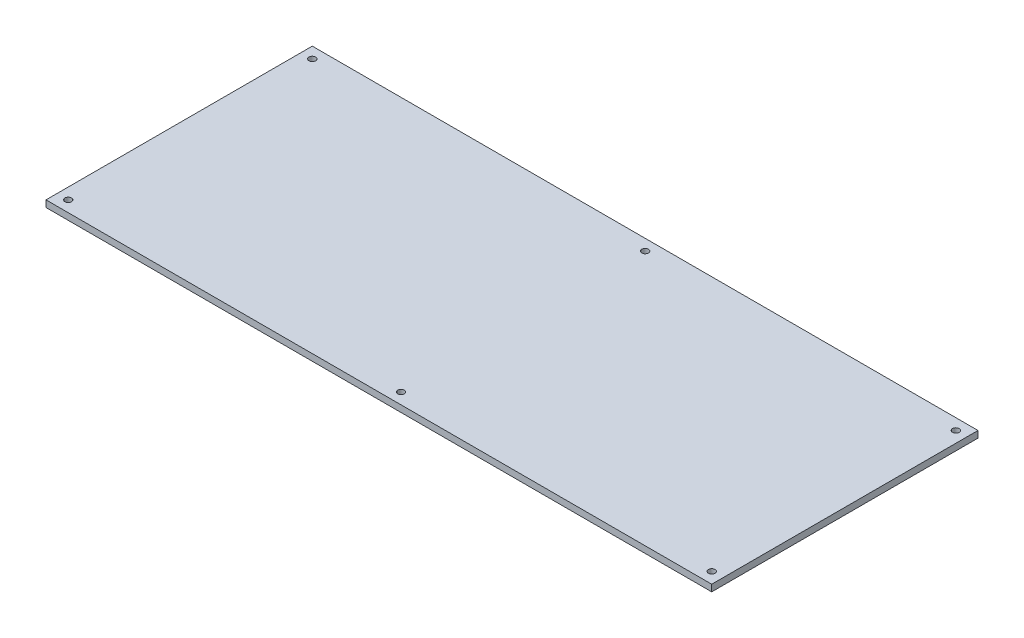
from build123d import *

# Parameters (mm, degrees)
SKETCH1_W           = 300
SKETCH1_H           = 120
SKETCH1_R           = 1.5
BOSS_EXTRUDE1_DEPTH = 3


with BuildPart() as part:
    # Sketch1 → Boss-Extrude1 (new body)
    with BuildSketch(Plane(origin=(0, 0, 0), x_dir=(1, 0, 0), z_dir=(0, 1, 0))):
        Rectangle(SKETCH1_W, SKETCH1_H)
        with Locations((-145, 55)):
            Circle(SKETCH1_R, mode=Mode.SUBTRACT)
        with Locations((145, 55)):
            Circle(SKETCH1_R, mode=Mode.SUBTRACT)
        with Locations((-145, -55)):
            Circle(SKETCH1_R, mode=Mode.SUBTRACT)
        with Locations((145, -55)):
            Circle(SKETCH1_R, mode=Mode.SUBTRACT)
        with Locations((5, -55)):
            Circle(SKETCH1_R, mode=Mode.SUBTRACT)
        with Locations((5, 55)):
            Circle(SKETCH1_R, mode=Mode.SUBTRACT)
    extrude(amount=BOSS_EXTRUDE1_DEPTH)


solid = part.part
